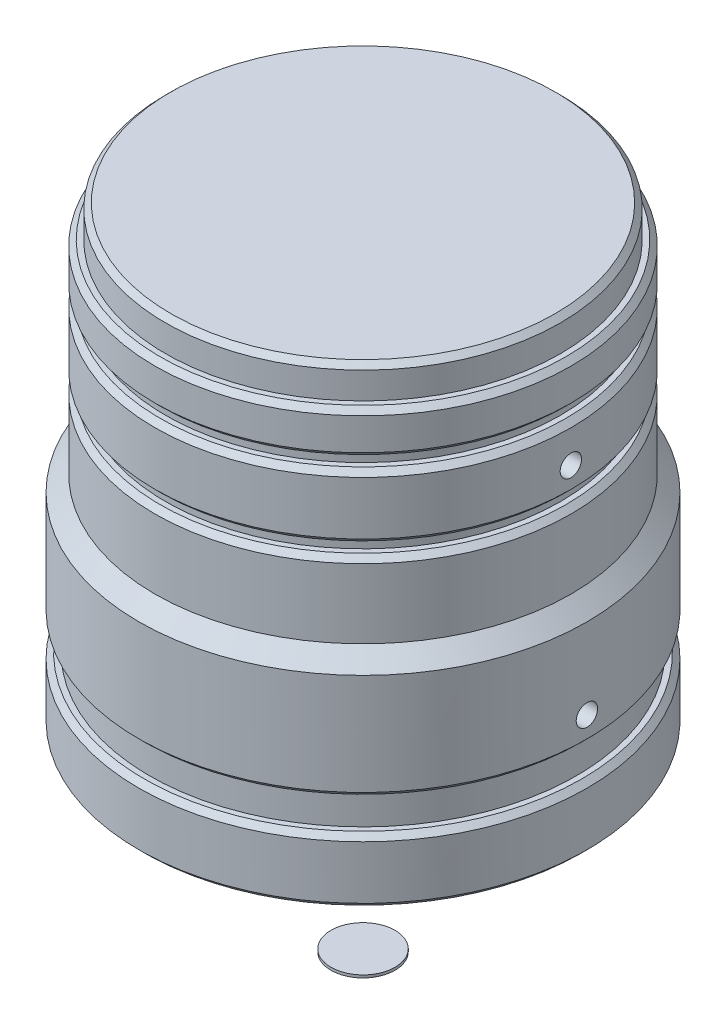
from build123d import *

# Parameters (mm, degrees)
F_5MM_BODY_CHAMFERS_SIZE           = 0.5
F_1_5MM_BODY_CHAMFERS_SIZE         = 1.5
F_48MM_X_28MM_BODY_CHAMFER_1_SIZE  = 0.28
F_48MM_X_28MM_BODY_CHAMFER_1_SIZE2 = 0.48
F_48MM_X_28MM_BODY_CHAMFER_2_SIZE  = 0.48
F_48MM_X_28MM_BODY_CHAMFER_2_SIZE2 = 0.28
SKETCH2_R                          = 9
SENSOR_HOLE_DEPTH                  = 10
SKETCH9_R                          = 3
FOCAL_POINT_DEPTH                  = 0.25
SKETCH10_R                         = 1
CUT_EXTRUDE1_DEPTH                 = 2
SKETCH11_R                         = 1
CUT_EXTRUDE2_DEPTH                 = 2


with BuildPart() as part:
    # Sketch1 → Lens Body (revolve)
    with BuildSketch(Plane.XY, mode=Mode.PRIVATE) as lens_body_sk:
        Polygon((0, 0), (18.5, 0), (18.5, -3), (19.5, -3), (19.5, -7), (18.5, -7), (18.5, -8), (19.5, -8), (19.5, -14), (18.5, -14), (18.5, -15), (19.5, -15), (19.5, -22), (21, -22), (21, -33.5), (20, -33.5), (20, -36.5), (21, -36.5), (21, -42.5), (18, -42.5), (18, -43), (12.18, -43), (12.18, -43.75), (12.7, -43.75), (12.7, -47), (0, -47), align=None)
    revolve(lens_body_sk.sketch.rotate(Axis((0, 0, 0), (0, -1, 0)), 180), axis=Axis((0, 0, 0), (0, -1, 0)))

    # .5mm Body Chamfers
    f_5mm_body_chamfers_edges = [part.edges().sort_by_distance(p)[0] for p in [
        (18, -43, 0),
        (21, -42.5, 0),
        (21, -36.5, 0),
        (21, -33.5, 0),
        (19.5, -15, 0),
        (19.5, -14, 0),
        (19.5, -8, 0),
        (19.5, -7, 0),
        (19.5, -3, 0),
        (18.5, 0, 0),
    ]]
    chamfer(f_5mm_body_chamfers_edges, length=F_5MM_BODY_CHAMFERS_SIZE - 0.0001)  # a hair under: the kernel refuses the full size

    # 1.5mm Body Chamfers
    f_1_5mm_body_chamfers_edges = [part.edges().sort_by_distance(p)[0] for p in [
        (21, -22, 0),
    ]]
    chamfer(f_1_5mm_body_chamfers_edges, length=F_1_5MM_BODY_CHAMFERS_SIZE - 0.0001)  # a hair under: the kernel refuses the full size

    # .48mm x .28mm Body Chamfer 1
    f_48mm_x_28mm_body_chamfer_1_edges = [part.edges().sort_by_distance(p)[0] for p in [
        (12.7, -43.75, 0),
    ]]
    f_48mm_x_28mm_body_chamfer_1_side = [part.faces().sort_by_distance(p)[0] for p in [
        (12.7, -45.375, 0),
    ]]
    chamfer(f_48mm_x_28mm_body_chamfer_1_edges, length=F_48MM_X_28MM_BODY_CHAMFER_1_SIZE, length2=F_48MM_X_28MM_BODY_CHAMFER_1_SIZE2, reference=f_48mm_x_28mm_body_chamfer_1_side[0])

    # .48mm x .28mm Body Chamfer 2
    f_48mm_x_28mm_body_chamfer_2_edges = [part.edges().sort_by_distance(p)[0] for p in [
        (12.7, -47, 0),
    ]]
    f_48mm_x_28mm_body_chamfer_2_side = [part.faces().sort_by_distance(p)[0] for p in [
        (0, -47, 0),
    ]]
    chamfer(f_48mm_x_28mm_body_chamfer_2_edges, length=F_48MM_X_28MM_BODY_CHAMFER_2_SIZE, length2=F_48MM_X_28MM_BODY_CHAMFER_2_SIZE2, reference=f_48mm_x_28mm_body_chamfer_2_side[0])

    # Sketch2 → Sensor Hole (cut)
    with BuildSketch(Plane.XZ.offset(47)):
        Circle(SKETCH2_R)
    extrude(amount=-SENSOR_HOLE_DEPTH, mode=Mode.SUBTRACT)

    # Sketch10 → Cut-Extrude1 (cut)
    with BuildSketch(Plane(origin=(21, 0, 0), x_dir=(0, 0, -1), z_dir=(1, 0, 0))):
        with Locations((0, -31.05)):
            Circle(SKETCH10_R)
    extrude(amount=-CUT_EXTRUDE1_DEPTH, mode=Mode.SUBTRACT)

    # Sketch11 → Cut-Extrude2 (cut)
    with BuildSketch(Plane(origin=(19.5, 0, 0), x_dir=(0, 0, -1), z_dir=(1, 0, 0))):
        with Locations((0, -11.55)):
            Circle(SKETCH11_R)
    extrude(amount=-CUT_EXTRUDE2_DEPTH, mode=Mode.SUBTRACT)


with BuildPart() as body_2:
    # Sketch9 → Focal Point (new body)
    with BuildSketch(Plane(origin=(0, -60.78, 0), x_dir=(1, 0, 0), z_dir=(0, 1, 0))):
        with Locations(Location((0, 0, 0), (0, 0, 180))):
            Circle(SKETCH9_R)
    extrude(amount=FOCAL_POINT_DEPTH)


solid = Compound([part.part, body_2.part])
